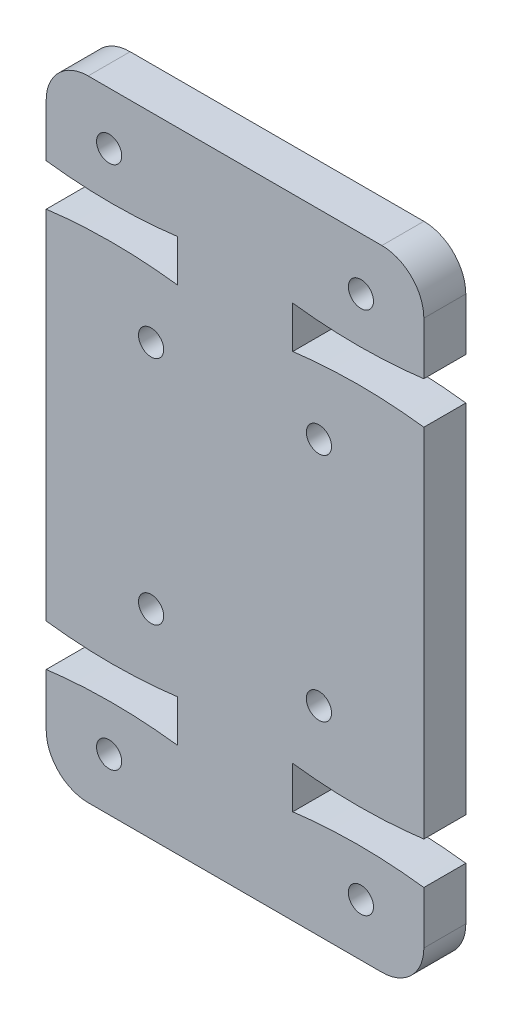
from build123d import *

# Parameters (mm, degrees)
SKETCH1_R               = 0.6
FINGER_PIP_BODY_DEPTH   = 2
FINGER_PIP_CONTOURING_R = 2


with BuildPart() as part:
    # Sketch1 → Finger PIP Body (new body)
    with BuildSketch(Plane.XY):
        with BuildLine():
            Line((0, 6.5), (0, 23.5))
            add(Edge.make_bspline(
                [(0, 23.5), (3.125, 23.9), (6.25, 23.5)],
                knots=[0, 0, 0, 1, 1, 1], degree=2))
            Line((6.25, 23.5), (6.25, 25.5))
            add(Edge.make_bspline(
                [(0, 25.5), (3.125, 25.1), (6.25, 25.5)],
                knots=[0, 0, 0, 1, 1, 1], degree=2))
            Line((0, 25.5), (0, 30))
            Line((0, 30), (18, 30))
            Line((18, 30), (18, 25.5))
            add(Edge.make_bspline(
                [(18, 25.5), (14.875, 25.1), (11.75, 25.5)],
                knots=[0, 0, 0, 1, 1, 1], degree=2))
            Line((11.75, 25.5), (11.75, 23.5))
            add(Edge.make_bspline(
                [(18, 23.5), (14.875, 23.9), (11.75, 23.5)],
                knots=[0, 0, 0, 1, 1, 1], degree=2))
            Line((18, 23.5), (18, 6.5))
            add(Edge.make_bspline(
                [(18, 6.5), (14.875, 6.1), (11.75, 6.5)],
                knots=[0, 0, 0, 1, 1, 1], degree=2))
            Line((11.75, 6.5), (11.75, 4.5))
            add(Edge.make_bspline(
                [(18, 4.5), (14.875, 4.9), (11.75, 4.5)],
                knots=[0, 0, 0, 1, 1, 1], degree=2))
            Line((18, 4.5), (18, 0))
            Line((18, 0), (0, 0))
            Line((0, 0), (0, 4.5))
            add(Edge.make_bspline(
                [(0, 4.5), (3.125, 4.9), (6.25, 4.5)],
                knots=[0, 0, 0, 1, 1, 1], degree=2))
            Line((6.25, 4.5), (6.25, 6.5))
            add(Edge.make_bspline(
                [(0, 6.5), (3.125, 6.1), (6.25, 6.5)],
                knots=[0, 0, 0, 1, 1, 1], degree=2))
        make_face()
        with Locations((3, 2.5)):
            Circle(SKETCH1_R, mode=Mode.SUBTRACT)
        with Locations((5, 9.5)):
            Circle(SKETCH1_R, mode=Mode.SUBTRACT)
        with Locations((5, 20.5)):
            Circle(SKETCH1_R, mode=Mode.SUBTRACT)
        with Locations((3, 27.5)):
            Circle(SKETCH1_R, mode=Mode.SUBTRACT)
        with Locations((15, 27.5)):
            Circle(SKETCH1_R, mode=Mode.SUBTRACT)
        with Locations((13, 20.5)):
            Circle(SKETCH1_R, mode=Mode.SUBTRACT)
        with Locations((13, 9.5)):
            Circle(SKETCH1_R, mode=Mode.SUBTRACT)
        with Locations((15, 2.5)):
            Circle(SKETCH1_R, mode=Mode.SUBTRACT)
    extrude(amount=FINGER_PIP_BODY_DEPTH)

    # Finger PIP Contouring
    finger_pip_contouring_edges = [part.edges().sort_by_distance(p)[0] for p in [
        (0, 30, 1),
        (18, 30, 1),
        (18, 0, 1),
        (0, 0, 1),
    ]]
    fillet(finger_pip_contouring_edges, radius=FINGER_PIP_CONTOURING_R)


solid = part.part
